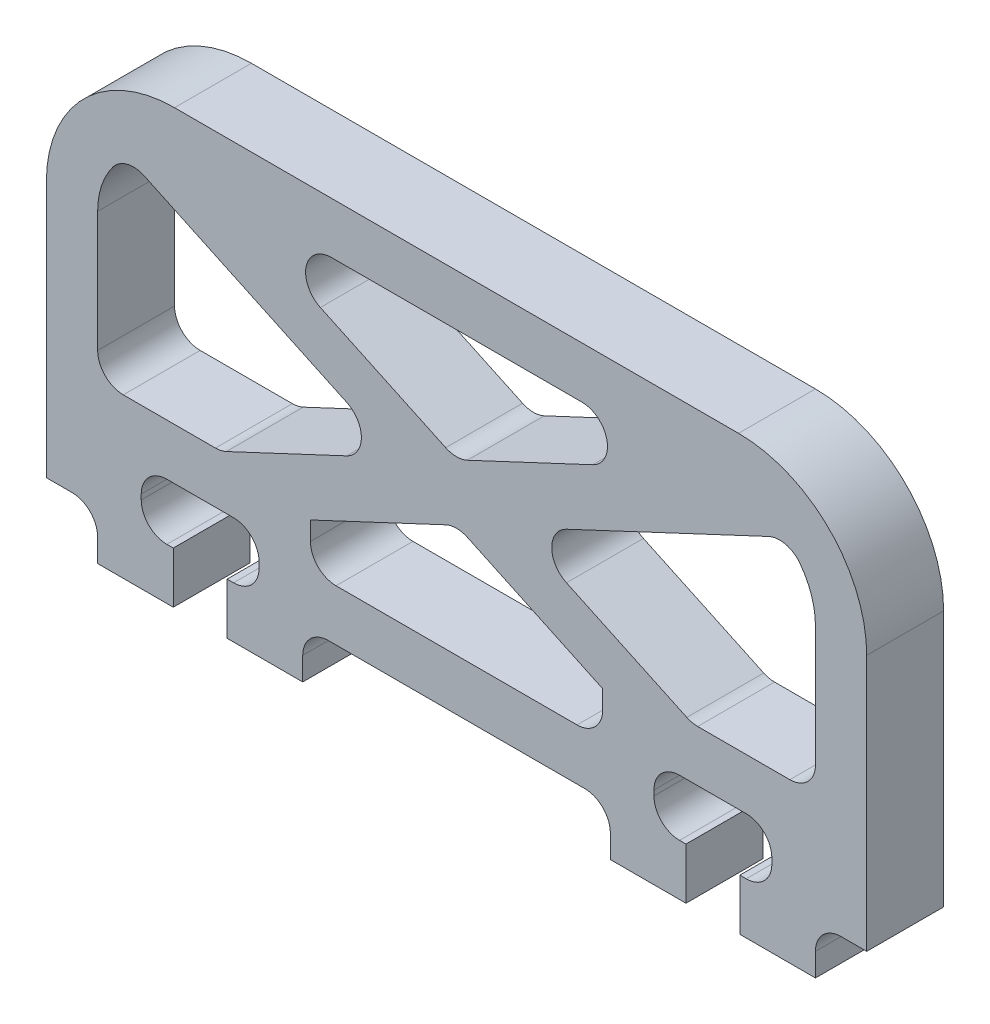
from build123d import *

# Parameters (mm, degrees)
BOSS_EXTRUDE2_DEPTH = 3
FILLET1_R           = 5
CUT_EXTRUDE1_REACH  = 20.798
FILLET2_R           = 1
FILLET3_R           = 1


with BuildPart() as part:
    # Sketch1 → Boss-Extrude2 (new body)
    with BuildSketch(Plane.XY):
        Polygon((16, 7.5), (-16, 7.5), (-16, -7.5), (-14, -7.5), (-14, -9.4), (-11.05, -9.4), (-11.05, -7.4), (-12.3, -7.4), (-12.3, -5.2), (-7.7, -5.2), (-7.7, -7.4), (-8.95, -7.4), (-8.95, -9.4), (-6, -9.4), (-6, -7.5), (6, -7.5), (6, -9.4), (8.95, -9.4), (8.95, -7.4), (7.7, -7.4), (7.7, -5.2), (12.3, -5.2), (12.3, -7.4), (11.05, -7.4), (11.05, -9.4), (14, -9.4), (14, -7.5), (16, -7.5), align=None)
    extrude(amount=BOSS_EXTRUDE2_DEPTH)

    # Fillet1
    fillet1_edges = [part.edges().sort_by_distance(p)[0] for p in [
        (16, 7.5, 1.5),
        (-16, 7.5, 1.5),
    ]]
    fillet(fillet1_edges, radius=FILLET1_R)

    # Sketch2 → Cut-Extrude1 (cut, up to next)
    with BuildSketch(Plane.XY.offset(3), mode=Mode.PRIVATE) as cut_extrude1_sk1:
        Polygon((5.7, -5.5), (5.7, -3.776287315), (0, -1.104412315), (-5.7, -3.776287315), (-5.7, -5.5), align=None)
    cut_extrude1_tool1 = extrude(cut_extrude1_sk1.sketch, amount=-CUT_EXTRUDE1_REACH, mode=Mode.PRIVATE) & part.part
    # Sketch2 → Cut-Extrude1 (cut, up to next)
    with BuildSketch(Plane.XY.offset(3), mode=Mode.PRIVATE) as cut_extrude1_sk2:
        with BuildLine():
            Line((2.356079606, 0), (9.182746273, -3.2))
            Line((9.182746273, -3.2), (14, -3.2))
            Line((14, -3.2), (14, 2.5))
            ThreePointArc((14, 2.5), (13.684292327, 3.839617373), (12.803616863, 4.897283089))
            Line((12.803616863, 4.897283089), (2.356079606, 0))
        make_face()
    cut_extrude1_tool2 = extrude(cut_extrude1_sk2.sketch, amount=-CUT_EXTRUDE1_REACH, mode=Mode.PRIVATE) & part.part
    # Sketch2 → Cut-Extrude1 (cut, up to next)
    with BuildSketch(Plane.XY.offset(3), mode=Mode.PRIVATE) as cut_extrude1_sk3:
        with BuildLine():
            Line((-9.182746273, -3.2), (-2.356079606, 0))
            Line((-2.356079606, 0), (-12.803616863, 4.897283089))
            ThreePointArc((-12.803616863, 4.897283089), (-13.684292327, 3.839617373), (-14, 2.5))
            Line((-14, 2.5), (-14, -3.2))
            Line((-14, -3.2), (-9.182746273, -3.2))
        make_face()
    cut_extrude1_tool3 = extrude(cut_extrude1_sk3.sketch, amount=-CUT_EXTRUDE1_REACH, mode=Mode.PRIVATE) & part.part
    # Sketch2 → Cut-Extrude1 (cut, up to next)
    with BuildSketch(Plane.XY.offset(3), mode=Mode.PRIVATE) as cut_extrude1_sk4:
        Polygon((-9.377253727, 5.5), (0, 1.104412315), (9.377253727, 5.5), align=None)
    cut_extrude1_tool4 = extrude(cut_extrude1_sk4.sketch, amount=-CUT_EXTRUDE1_REACH, mode=Mode.PRIVATE) & part.part
    add(cut_extrude1_tool1.solids().sort_by_distance((0, -3.872956, 3))[0], mode=Mode.SUBTRACT)
    add(cut_extrude1_tool2.solids().sort_by_distance((9.826991, 0.282116, 3))[0], mode=Mode.SUBTRACT)
    add(cut_extrude1_tool3.solids().sort_by_distance((-9.826991, 0.282116, 3))[0], mode=Mode.SUBTRACT)
    add(cut_extrude1_tool4.solids().sort_by_distance((0, 4.034804, 3))[0], mode=Mode.SUBTRACT)

    # Fillet2
    fillet2_edges = [part.edges().sort_by_distance(p)[0] for p in [
        (5.7, -5.5, 1.5),
        (-5.7, -5.5, 1.5),
        (0, -1.104412315, 1.5),
        (9.182746273, -3.2, 1.5),
        (2.356079606, 0, 1.5),
        (9.377253727, 5.5, 1.5),
        (-9.377253727, 5.5, 1.5),
        (0, 1.104412315, 1.5),
        (-2.356079606, 0, 1.5),
        (-9.182746273, -3.2, 1.5),
        (14, -3.2, 1.5),
        (12.803616863, 4.897283089, 1.5),
        (-12.803616863, 4.897283089, 1.5),
        (-14, -3.2, 1.5),
    ]]
    fillet(fillet2_edges, radius=FILLET2_R)

    # Fillet3
    fillet3_edges = [part.edges().sort_by_distance(p)[0] for p in [
        (12.3, -7.4, 1.5),
        (12.3, -5.2, 1.5),
        (7.7, -5.2, 1.5),
        (7.7, -7.4, 1.5),
        (-12.3, -7.4, 1.5),
        (-7.7, -7.4, 1.5),
        (-7.7, -5.2, 1.5),
        (-12.3, -5.2, 1.5),
        (14, -7.5, 1.5),
        (6, -7.5, 1.5),
        (-14, -7.5, 1.5),
        (-6, -7.5, 1.5),
    ]]
    fillet(fillet3_edges, radius=FILLET3_R)


solid = part.part
